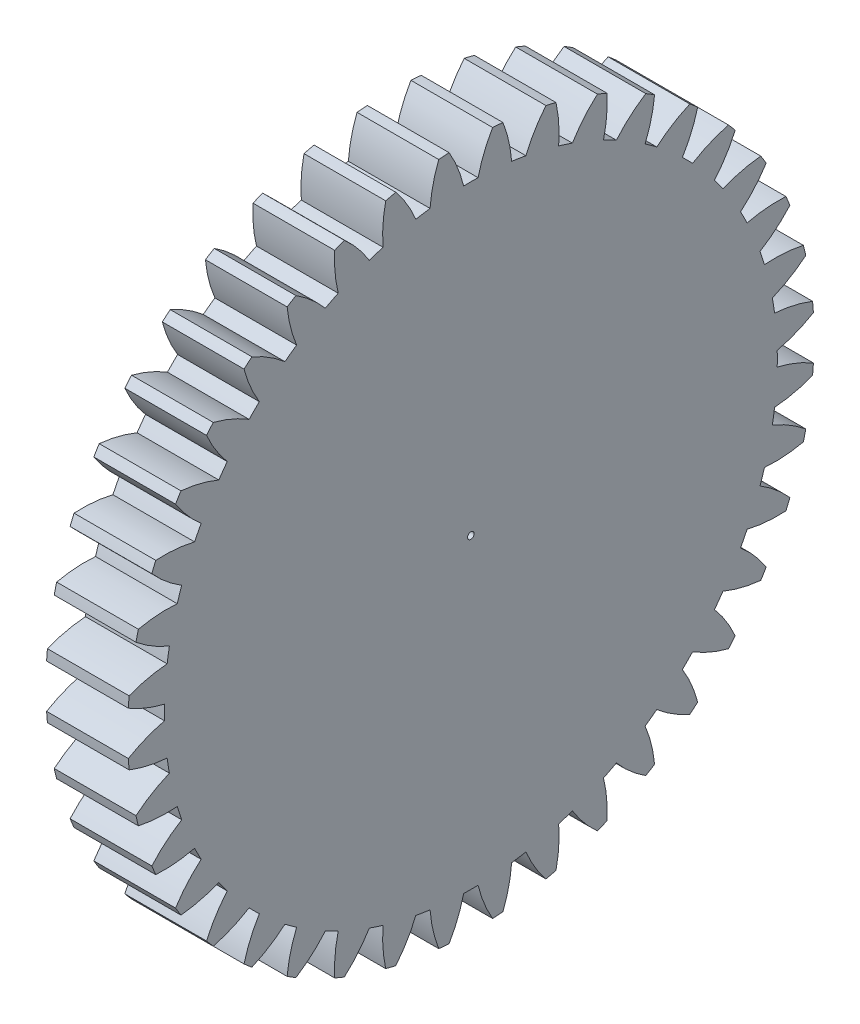
from build123d import *

# Parameters (mm, degrees)
BASPROSKE_W     = 10
BASPROSKE_H     = 42
TOOTHCUT_DEPTH  = 61.232881386
TEETHCUTS_COUNT = 40
TEETHCUTS_ANGLE = 351
BORSKE_R        = 0.4
BORE_DEPTH      = 50.0000508


with BuildPart() as part:
    # BasProSke → Base-Revolve (revolve)
    with BuildSketch(Plane(origin=(0, 0, 0), x_dir=(1, 0, 0), z_dir=(0, 1, 0))):
        with Locations((5, 21)):
            Rectangle(BASPROSKE_W, BASPROSKE_H)
    revolve(axis=Axis((-10, 0, 0), (1, 0, 0)))

    # TooCutSke → ToothCut (cut, through all)
    with BuildSketch(Plane(origin=(0, 0, 0), x_dir=(0, 0, -1), z_dir=(1, 0, 0))):
        with BuildLine():
            ThreePointArc((0.882812088, 37.488606854), (0, 37.499), (-0.882812088, 37.488606854))
            ThreePointArc((-0.882812088, 37.488606854), (-1.612748684, 39.782000434), (-2.678427154, 41.939960338))
            ThreePointArc((-2.678427154, 41.939960338), (0, 42.0254), (2.678427154, 41.939960338))
            ThreePointArc((2.678427154, 41.939960338), (1.612748684, 39.782000434), (0.882812088, 37.488606854))
        make_face()
    toothcut = extrude(amount=TOOTHCUT_DEPTH, mode=Mode.SUBTRACT)

    # TeethCuts: ToothCut ×40 about axis
    teethcuts_axis = Axis((-10, 0, 0), (1, 0, 0))
    for i in range(1, TEETHCUTS_COUNT):
        add(toothcut.rotate(teethcuts_axis, i * TEETHCUTS_ANGLE / (TEETHCUTS_COUNT - 1)), mode=Mode.SUBTRACT)

    # BorSke → Bore (cut, symmetric)
    with BuildSketch(Plane(origin=(0, 0, 0), x_dir=(0, 0, -1), z_dir=(1, 0, 0))):
        Circle(BORSKE_R)
    extrude(amount=BORE_DEPTH, both=True, mode=Mode.SUBTRACT)


solid = part.part
